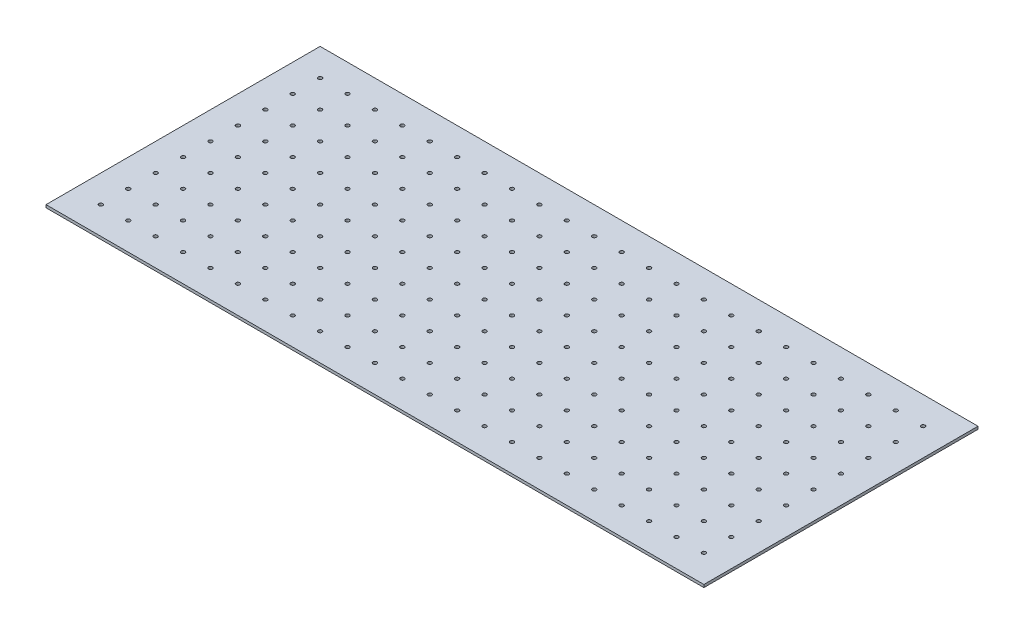
from build123d import *

# Parameters (mm, degrees)
CROQUIS1_W              = 1200
CROQUIS1_H              = 500
SALIENTE_EXTRUIR1_DEPTH = 5
CROQUIS3_R              = 3.5
CORTAR_EXTRUIR2_DEPTH   = 651.019230485
MATRIZL1_COUNT          = 23
MATRIZL1_PITCH          = 50
MATRIZL1_COUNT_DIR2     = 9
MATRIZL1_PITCH_DIR2     = 50


with BuildPart() as part:
    # Croquis1 → Saliente-Extruir1 (new body)
    with BuildSketch(Plane(origin=(0, 0, 0), x_dir=(1, 0, 0), z_dir=(0, 1, 0))):
        Rectangle(CROQUIS1_W, CROQUIS1_H)
    extrude(amount=SALIENTE_EXTRUIR1_DEPTH)

    # Croquis3 → Cortar-Extruir2 (cut, through all)
    with BuildSketch(Plane(origin=(0, 5, 0), x_dir=(1, 0, 0), z_dir=(0, 1, 0))):
        with Locations((-550, 200)):
            Circle(CROQUIS3_R)
    cortar_extruir2 = extrude(amount=-CORTAR_EXTRUIR2_DEPTH, mode=Mode.SUBTRACT)

    # MatrizL1: Cortar-Extruir2 23 × 9
    with Locations(*[(i * MATRIZL1_PITCH, 0, j * MATRIZL1_PITCH_DIR2) for i in range(MATRIZL1_COUNT) for j in range(MATRIZL1_COUNT_DIR2) if (i, j) != (0, 0)]):
        add(cortar_extruir2, mode=Mode.SUBTRACT)


solid = part.part
